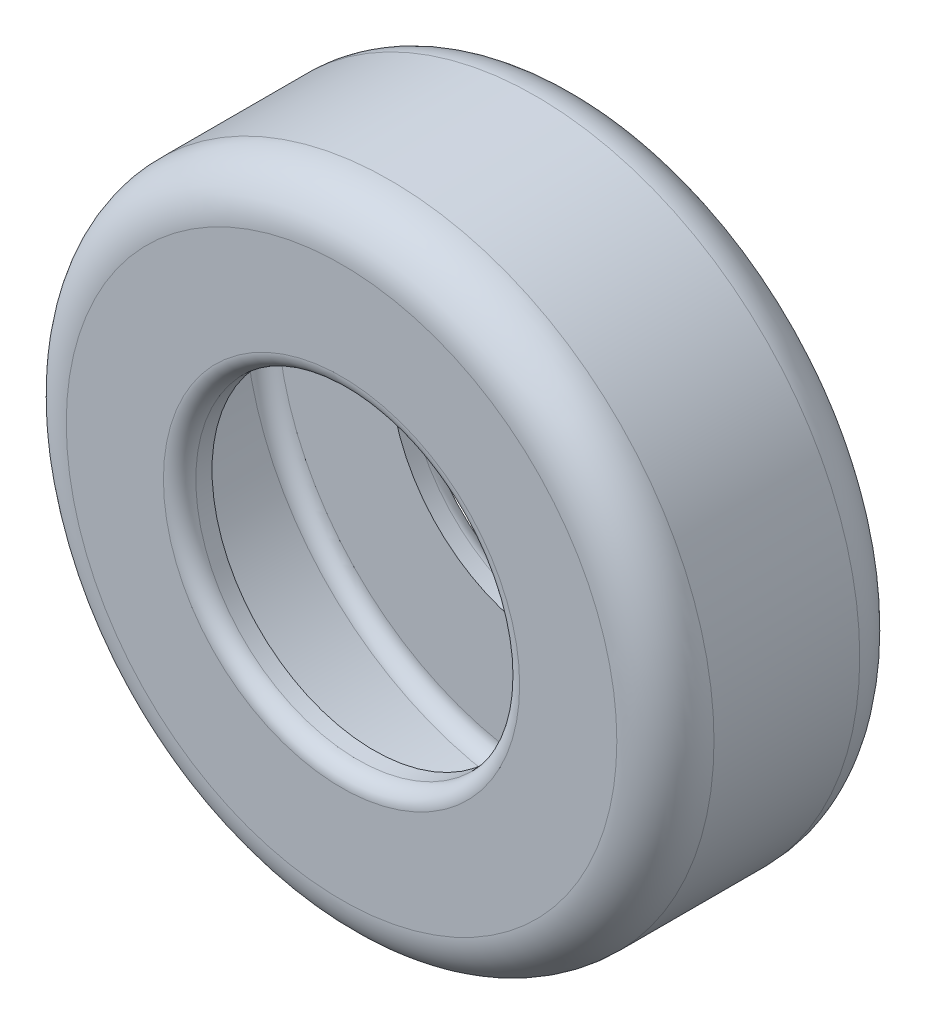
from build123d import *

# Parameters (mm, degrees)
SKETCH2_R           = 20
SKETCH2_R_2         = 10
EXTRUDE_THIN1_DEPTH = 15
FILLET1_R           = 3
FILLET2_R           = 1


# Read off the part's stored shape, not the designer's step: Shell1
with BuildPart() as part:
    # Sketch2 → Extrude-Thin1 (new body)
    with BuildSketch(Plane.XY):
        Circle(SKETCH2_R)
        Circle(SKETCH2_R_2, mode=Mode.SUBTRACT)
    extrude(amount=EXTRUDE_THIN1_DEPTH)

    # Fillet1
    fillet1_edges = [part.edges().sort_by_distance(p)[0] for p in [
        (-20, 0, 0),
        (-20, 0, 15),
    ]]
    fillet(fillet1_edges, radius=FILLET1_R)

    # Fillet2
    fillet2_edges = [part.edges().sort_by_distance(p)[0] for p in [
        (-10, 0, 0),
        (-10, 0, 15),
    ]]
    fillet(fillet2_edges, radius=FILLET2_R)

    # Shell1 outline → Shell1 (revolve, cut)
    with BuildSketch(Plane.XZ):
        with BuildLine():
            Line((17, 13), (10, 13))
            Line((10, 13), (10, 2))
            Line((10, 2), (17, 2))
            ThreePointArc((17, 2), (17.707106781, 2.292893219), (18, 3))
            Line((18, 3), (18, 12))
            ThreePointArc((18, 12), (17.707106781, 12.707106781), (17, 13))
        make_face()
    revolve(axis=Axis((0, 0, 0), (0, 0, 1)), mode=Mode.SUBTRACT)


solid = part.part
